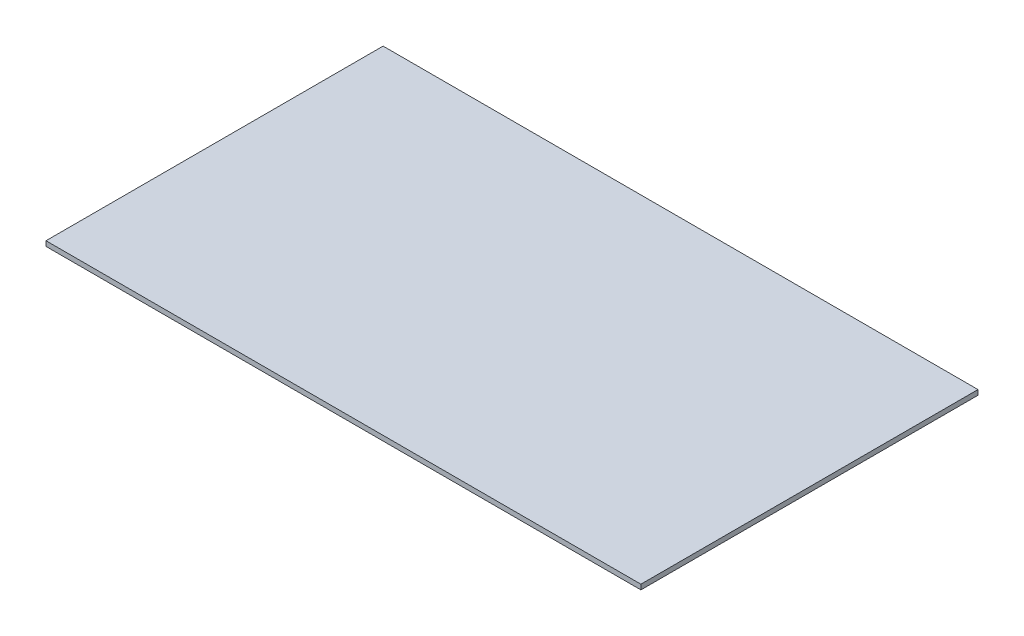
from build123d import *

# Parameters (mm, degrees)
SKETCH1_W           = 762
SKETCH1_H           = 431.8
BOSS_EXTRUDE1_DEPTH = 6.35


with BuildPart() as part:
    # Sketch1 → Boss-Extrude1 (new body)
    with BuildSketch(Plane(origin=(0, 0, 0), x_dir=(1, 0, 0), z_dir=(0, 1, 0))):
        with Locations((381, 215.9)):
            Rectangle(SKETCH1_W, SKETCH1_H)
    extrude(amount=BOSS_EXTRUDE1_DEPTH)


solid = part.part
